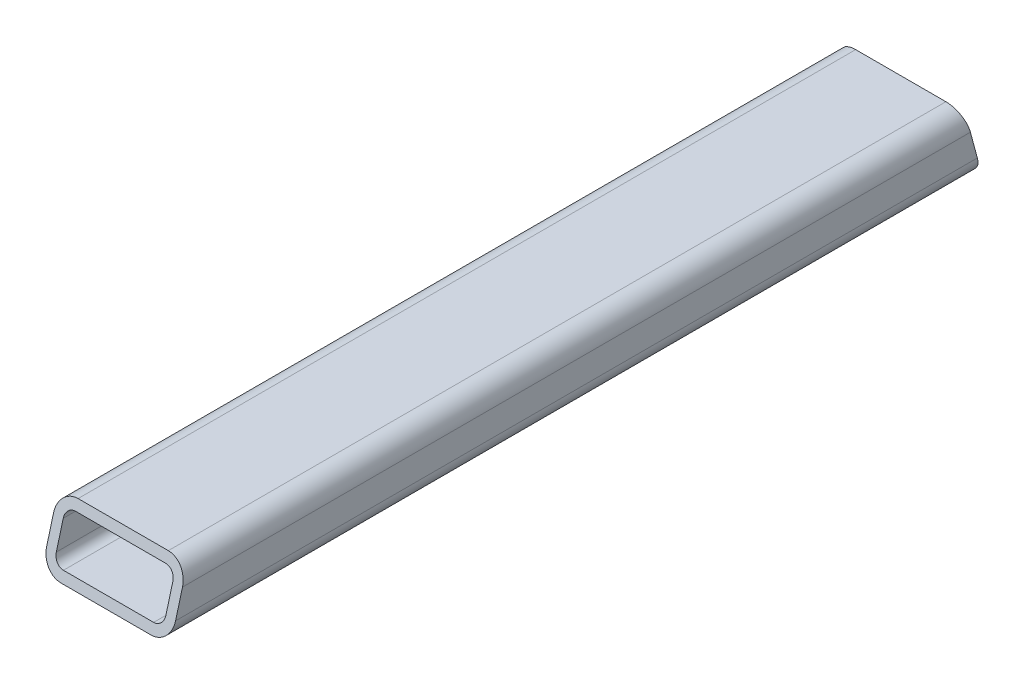
from build123d import *

# Parameters (mm, degrees)
EXTRUDE_1_DEPTH      = 126
EXTRUDE_1_DEPTH_BACK = 126
SHELL_1_T            = -3
CHAMFER_1_SIZE       = 5.358983849
CHAMFER_1_SIZE_2     = 20


with BuildPart() as part:
    # Эскиз1 → Бобышка-Вытянуть1 (new, two sides: drawn at the far end of the back side and taken through both)
    with BuildSketch(Plane.XY.offset(-EXTRUDE_1_DEPTH_BACK)):
        with BuildLine():
            Line((-14, 10), (14, 10))
            ThreePointArc((14, 10), (18.242640687, 8.242640687), (20, 4))
            Line((20, 4), (20, -4))
            ThreePointArc((20, -4), (18.242640687, -8.242640687), (14, -10))
            Line((14, -10), (-14, -10))
            ThreePointArc((-14, -10), (-18.242640687, -8.242640687), (-20, -4))
            Line((-20, -4), (-20, 4))
            ThreePointArc((-20, 4), (-18.242640687, 8.242640687), (-14, 10))
        make_face()
    extrude(amount=EXTRUDE_1_DEPTH + EXTRUDE_1_DEPTH_BACK)

    # Оболочка1
    shell_1_openings = [part.faces().sort_by_distance(p)[0] for p in [
        (0, 0, -126),
        (0, 0, 126),
    ]]
    offset(amount=SHELL_1_T, openings=shell_1_openings, kind=Kind.INTERSECTION)

    # Фаска1
    # the kernel refuses this chamfer: 20, 5.358983849 mm, written as the material it takes off along each edge
    with BuildSketch(Plane(origin=(-65.934431404, 10, -126), x_dir=(0, 0.13751244702128945, 0.9905000388259543), z_dir=(1, 0, 0))) as chamfer_1_piece_1:
        Polygon((CHAMFER_1_SIZE * 0.990500038756, CHAMFER_1_SIZE * 0.137512447012), (-CHAMFER_1_SIZE_2 * 0.137512447021, CHAMFER_1_SIZE_2 * 0.990500038826), (0, 0), align=None)
    extrude(amount=131.868862808, mode=Mode.SUBTRACT)
    with BuildSketch(Plane(origin=(-65.934431404, 10, 126), x_dir=(0, 0.13751244702128945, -0.9905000388259543), z_dir=(1, 0, 0))) as chamfer_1_piece_2:
        Polygon((CHAMFER_1_SIZE * 0.990500038756, -CHAMFER_1_SIZE * 0.137512447012), (-CHAMFER_1_SIZE_2 * 0.137512447021, -CHAMFER_1_SIZE_2 * 0.990500038826), (0, 0), align=None)
    extrude(amount=131.868862808, mode=Mode.SUBTRACT)


solid = part.part
